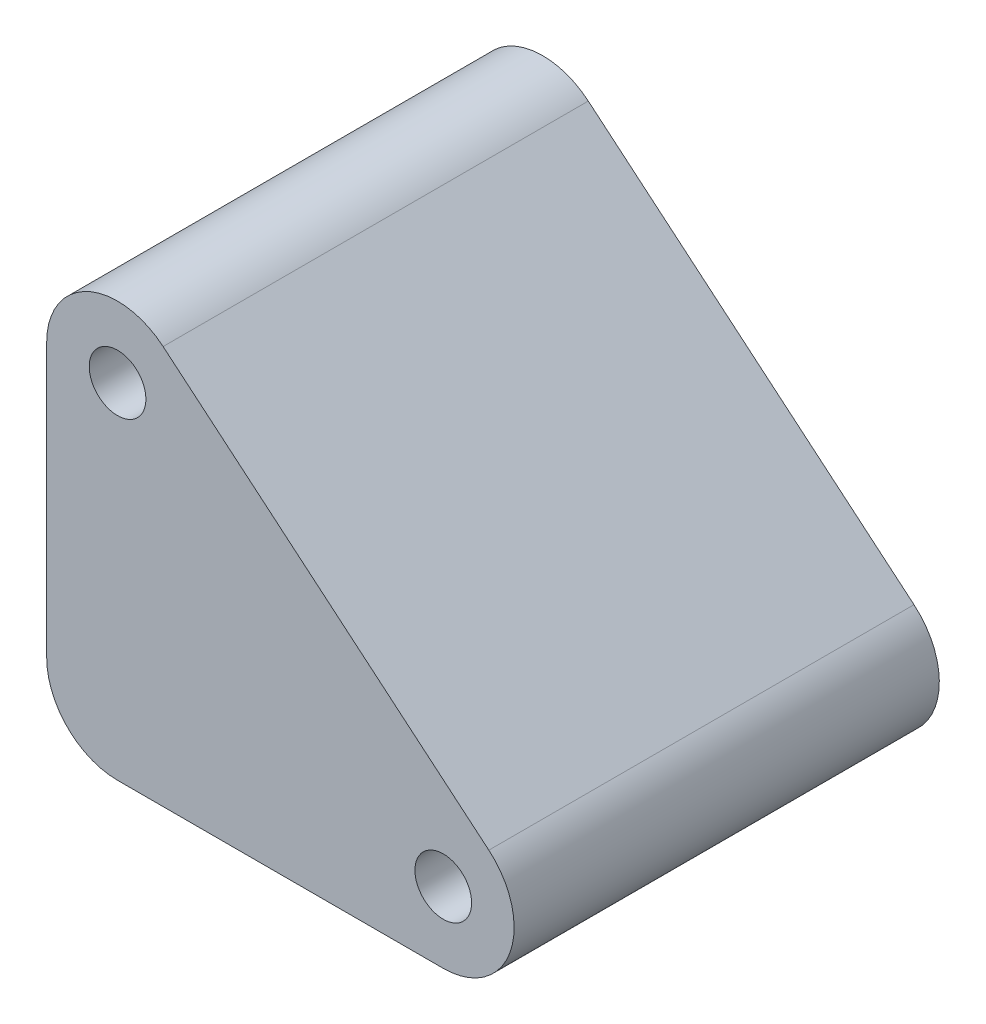
from build123d import *

# Parameters (mm, degrees)
BOSS_EXTRUDE1_DEPTH      = 15
BOSS_EXTRUDE1_DEPTH_BACK = 15
SKETCH1_R                = 2


with BuildPart() as part:
    # Sketch1 → Boss-Extrude1 (new, two sides: drawn at the far end of the back side and taken through both)
    with BuildSketch(Plane.XY.offset(-BOSS_EXTRUDE1_DEPTH_BACK)):
        with BuildLine():
            Line((-254.592454227, -14.883678526), (-231.611120933, -34.167306817))
            ThreePointArc((-231.611120933, -34.167306817), (-230.126595878, -39.707629749), (-234.825058982, -42.997529032))
            Line((-234.825058982, -42.997529032), (-257.806392275, -42.997529032))
            ThreePointArc((-257.806392275, -42.997529032), (-261.341926181, -41.533062938), (-262.806392275, -37.997529032))
            Line((-262.806392275, -37.997529032), (-262.806392275, -18.713900742))
            ThreePointArc((-262.806392275, -18.713900742), (-259.919483584, -14.182361807), (-254.592454227, -14.883678526))
        make_face()
        with Locations((-234.825058982, -37.997529032)):
            Circle(SKETCH1_R, mode=Mode.SUBTRACT)
        with Locations((-257.806392275, -18.713900742)):
            Circle(SKETCH1_R, mode=Mode.SUBTRACT)
    extrude(amount=BOSS_EXTRUDE1_DEPTH + BOSS_EXTRUDE1_DEPTH_BACK)


solid = part.part
